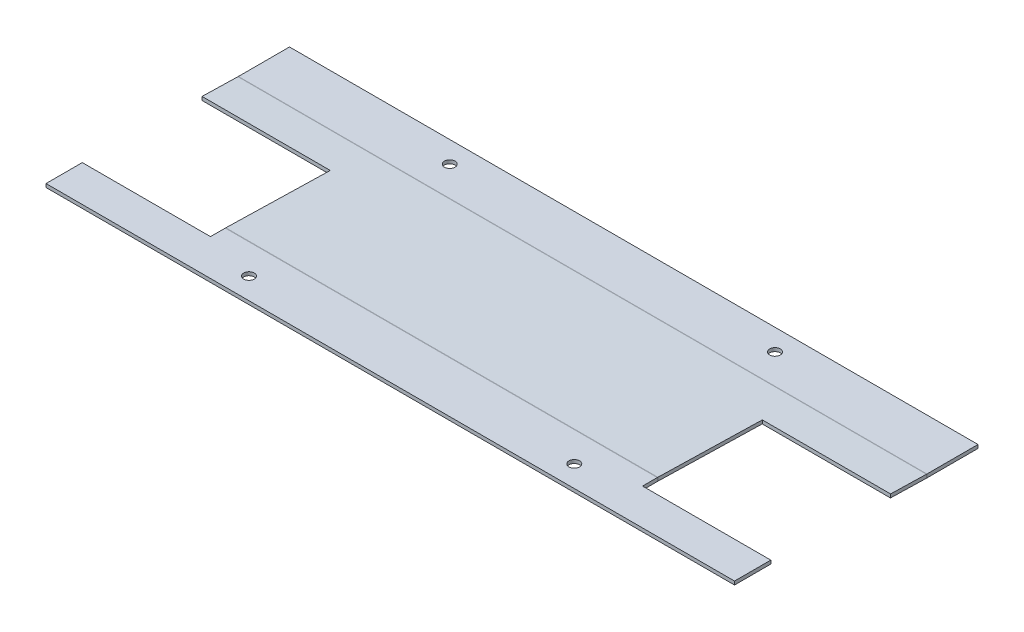
from build123d import *

# Parameters (mm, degrees)
SKETCH1_W               = 402.68
SKETCH1_H               = 30
BOSS_EXTRUDE1_DEPTH     = 2.03
SKETCH2_W               = 402.68
SKETCH2_H               = 30
BOSS_EXTRUDE2_DEPTH     = 2.03
CONVERT_SOLID1_START    = -201.34
CONVERT_SOLID1_DEPTH    = 402.68
CONVERT_SOLID1_2_DEPTH  = 402.68
CUT_EXTRUDE1_START      = -201.34
CUT_EXTRUDE1_DEPTH      = 75
CUT_EXTRUDE1_START_2    = 126.34
CUT_EXTRUDE1_2_DEPTH    = 75
CUT_EXTRUDE2_DEPTH      = 239.296116766
CUT_EXTRUDE2_DEPTH_BACK = 239.296116766
SKETCH8_R               = 3.1
CUT_EXTRUDE3_DEPTH      = 239.27017557
CUT_EXTRUDE3_DEPTH_BACK = 239.27017557
SKETCH10_R              = 3.1


# Read off the part's stored shape, not the designer's step: Convert-Solid1, Cut-Extrude1
with BuildPart() as part:
    # Sketch1 → Boss-Extrude1 (new body)
    with BuildSketch(Plane(origin=(0, 0, 0), x_dir=(1, 0, 0), z_dir=(0, 1, 0))):
        Rectangle(SKETCH1_W, SKETCH1_H)
    extrude(amount=BOSS_EXTRUDE1_DEPTH)


with BuildPart() as body_2:
    # Sketch2 → Boss-Extrude2 (new body)
    with BuildSketch(Plane(origin=(0, 0, 0), x_dir=(1, 0, 0), z_dir=(0, 1, 0))):
        with Locations((0, 112.4)):
            Rectangle(SKETCH2_W, SKETCH2_H)
    extrude(amount=-BOSS_EXTRUDE2_DEPTH)


    add(part.part)  # loft1 joins it to this body
    # loft from a face of the part (loft1)
    loft([body_2.faces().sort_by_distance((0, -1.015, -97.4))[0], body_2.faces().sort_by_distance((0, 1.015, -15))[0]])

    # Convert-Solid1 outline → Convert-Solid1 (cut)
    with BuildSketch(Plane.YZ.offset(CONVERT_SOLID1_START)):
        with BuildLine():
            ThreePointArc((2.03, -14.851837405), (2.029087712, -14.999988764), (2.026350985, -15.148117654))
            Line((2.026350985, -15.148117654), (2.03, -15))
            Line((2.03, -15), (2.03, -14.851837405))
        make_face()
        with BuildLine():
            ThreePointArc((-2.03, -97.523160927), (-2.029683266, -97.435865309), (-2.02873308, -97.348574287))
            Line((-2.02873308, -97.348574287), (-2.03, -97.4))
            Line((-2.03, -97.4), (-2.03, -97.523160927))
        make_face()
    extrude(amount=CONVERT_SOLID1_DEPTH, mode=Mode.SUBTRACT)

    # Convert-Solid1 2 outline → Convert-Solid1 2 (add)
    with BuildSketch(Plane.YZ.offset(CONVERT_SOLID1_START)):
        with BuildLine():
            Line((0, -97.4), (0, -97.523160927))
            ThreePointArc((0, -97.523160927), (0.000758344, -97.40000934), (0.003033263, -97.276876431))
            Line((0.003033263, -97.276876431), (0, -97.4))
        make_face()
        with BuildLine():
            ThreePointArc((0, -14.851837405), (-0.000758344, -14.974988992), (-0.003033263, -15.098121901))
            Line((-0.003033263, -15.098121901), (-2.026350985, -97.226880678))
            ThreePointArc((-2.026350985, -97.226880678), (-2.027695942, -97.28772447), (-2.02873308, -97.348574287))
            Line((-2.02873308, -97.348574287), (0, -15))
            Line((0, -15), (0, -14.851837405))
        make_face()
    extrude(amount=CONVERT_SOLID1_2_DEPTH)

    # Cut-Extrude1 outline → Cut-Extrude1 (cut)
    with BuildSketch(Plane.YZ.offset(CUT_EXTRUDE1_START)):
        with BuildLine():
            Line((-0.003033263, -15.098121901), (-1.508642262, -76.212497042))
            Line((-1.508642262, -76.212497042), (0.520741986, -76.262492795))
            Line((0.520741986, -76.262492795), (2.026350985, -15.148117654))
            ThreePointArc((2.026350985, -15.148117654), (2.029087712, -14.999988764), (2.03, -14.851837405))
            Line((2.03, -14.851837405), (2.03, -6.212497042))
            Line((2.03, -6.212497042), (0, -6.212497042))
            Line((0, -6.212497042), (0, -14.851837405))
            ThreePointArc((0, -14.851837405), (-0.000758344, -14.974988992), (-0.003033263, -15.098121901))
        make_face()
    extrude(amount=CUT_EXTRUDE1_DEPTH, mode=Mode.SUBTRACT)

    # Cut-Extrude1 2 outline → Cut-Extrude1 2 (cut)
    with BuildSketch(Plane.YZ.offset(CUT_EXTRUDE1_START_2)):
        with BuildLine():
            Line((-0.003033263, -15.098121901), (-1.508642262, -76.212497042))
            Line((-1.508642262, -76.212497042), (0.520741986, -76.262492795))
            Line((0.520741986, -76.262492795), (2.026350985, -15.148117654))
            ThreePointArc((2.026350985, -15.148117654), (2.029087712, -14.999988764), (2.03, -14.851837405))
            Line((2.03, -14.851837405), (2.03, -6.212497042))
            Line((2.03, -6.212497042), (0, -6.212497042))
            Line((0, -6.212497042), (0, -14.851837405))
            ThreePointArc((0, -14.851837405), (-0.000758344, -14.974988992), (-0.003033263, -15.098121901))
        make_face()
    extrude(amount=CUT_EXTRUDE1_2_DEPTH, mode=Mode.SUBTRACT)

    # Sketch8 → Cut-Extrude2 (cut, two sides: drawn at the far end of the back side and taken through both)
    with BuildSketch(Plane.XZ.offset(2.03).offset(-CUT_EXTRUDE2_DEPTH_BACK)):
        with Locations(Location((95.117, -114.9, 0), (0, 0, 270))):
            Circle(SKETCH8_R)
        with Locations(Location((-95.117, -114.9, 0), (0, 0, 270))):
            Circle(SKETCH8_R)
    extrude(amount=CUT_EXTRUDE2_DEPTH + CUT_EXTRUDE2_DEPTH_BACK, mode=Mode.SUBTRACT)

    # Sketch10 → Cut-Extrude3 (cut, two sides: drawn at the far end of the back side and taken through both)
    with BuildSketch(Plane.XZ.offset(-CUT_EXTRUDE3_DEPTH_BACK)):
        with Locations(Location((95.116996944, 2.5, 0), (0, 0, 270))):
            Circle(SKETCH10_R)
        with Locations(Location((-95.117, 2.5, 0), (0, 0, 270))):
            Circle(SKETCH10_R)
    extrude(amount=CUT_EXTRUDE3_DEPTH + CUT_EXTRUDE3_DEPTH_BACK, mode=Mode.SUBTRACT)


solid = body_2.part
